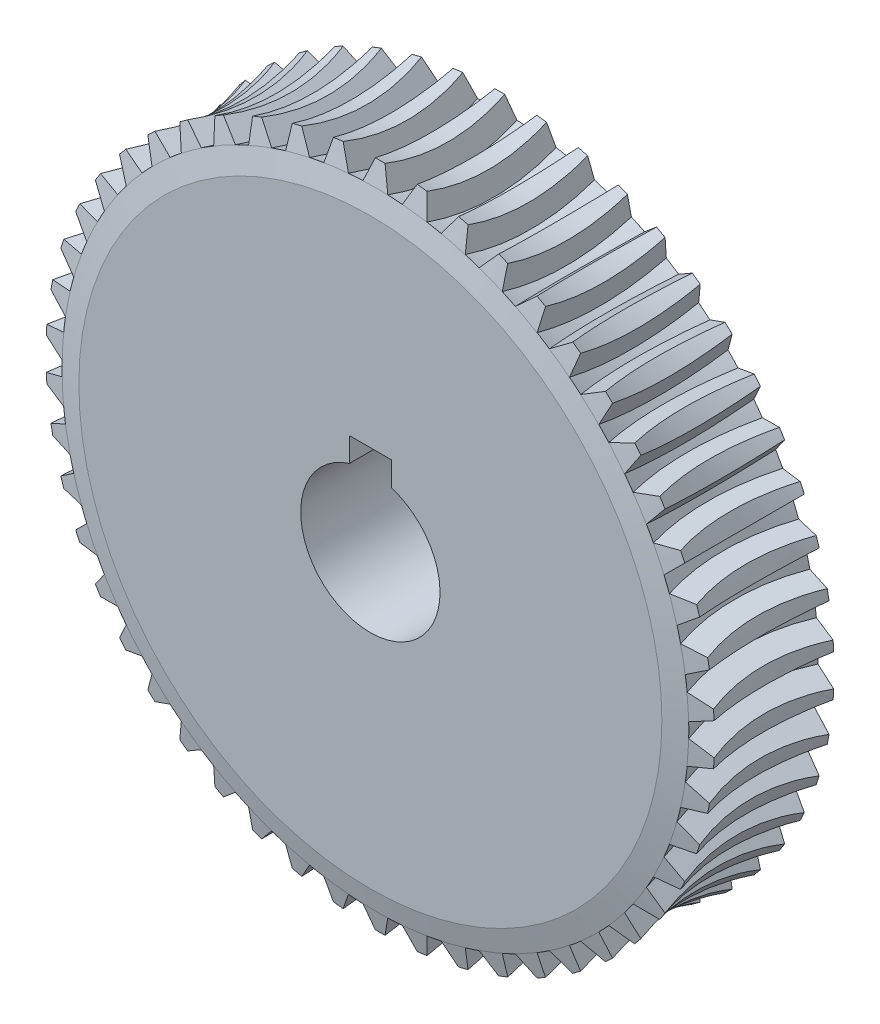
from build123d import *

# Parameters (mm, degrees)
SKETCH1_R               = 22.5
BOSS_EXTRUDE1_DEPTH     = 10
BOSS_EXTRUDE2_DEPTH     = 9.28
CIRPATTERN1_COUNT       = 50
SKETCH7_R               = 11.5
BOSS_EXTRUDE3_DEPTH     = 6.8
CUT_EXTRUDE1_DEPTH      = 38.855281345
CUT_EXTRUDE1_DEPTH_BACK = 38.855281345
SKETCH8_R               = 5
CUT_EXTRUDE2_DEPTH      = 38.855281345
CUT_EXTRUDE2_DEPTH_BACK = 38.855281345
SKETCH9_W               = 3
SKETCH9_H               = 4.772104456


with BuildPart() as part:
    # Sketch1 → Boss-Extrude1 (new body)
    with BuildSketch(Plane.XY):
        Circle(SKETCH1_R)
    extrude(amount=BOSS_EXTRUDE1_DEPTH)

    # Sketch2 → Cut-Revolve1 (revolve, cut)
    with BuildSketch(Plane(origin=(0, 0, 0), x_dir=(1, 0, 0), z_dir=(0, 1, 0))):
        Polygon((-22.5, -9.64), (-22.5, -10), (-20.93, -10), align=None)
        Polygon((-22.5, -0.36), (-20.93, 0), (-22.5, 0), align=None)
    revolve(axis=Axis((0, 0, 10), (0, 0, -1)), mode=Mode.SUBTRACT)

    # Sketch3 → Cut-Revolve2 (revolve, cut)
    with BuildSketch(Plane(origin=(0, 0, 0), x_dir=(1, 0, 0), z_dir=(0, 1, 0))):
        with BuildLine():
            ThreePointArc((-22.5, -9.64), (-21.830796064, -5), (-22.5, -0.36))
            Line((-22.5, -0.36), (-22.5, -9.64))
        make_face()
    revolve(axis=Axis((0, 0, 0), (0, 0, 1)), mode=Mode.SUBTRACT)

    # Sketch4 → Boss-Extrude2 (add)
    with BuildSketch(Plane(origin=(0, 0, 0.36), x_dir=(-1, 0, 0), z_dir=(0, 0, -1))):
        Polygon((-0.35, 24), (-0.89, 22.482390887), (-1.237647162, 21.505367738), (-0.89, 21.505367738), (0.89, 21.505367738), (1.237647162, 21.505367738), (0.89, 22.482390887), (0.35, 24), align=None)
    boss_extrude2 = extrude(amount=-BOSS_EXTRUDE2_DEPTH)

    # CirPattern1: Boss-Extrude2 ×50 about axis
    cirpattern1_axis = Axis((0, 0, 0.36), (0, 0, -1))
    for i in range(1, CIRPATTERN1_COUNT):
        add(boss_extrude2.rotate(cirpattern1_axis, i * 360 / CIRPATTERN1_COUNT))

    # Sketch5 → Cut-Revolve3 (revolve, cut)
    with BuildSketch(Plane(origin=(0, 0, 0), x_dir=(0, 0, -1), z_dir=(1, 0, 0))):
        Polygon((-1.165710418, 26.003012651), (-0.36, 22.489219995), (-0.36, 26.003012651), align=None)
        Polygon((-9.64, 26.003012651), (-9.64, 22.489219995), (-8.834289582, 26.003012651), align=None)
    revolve(axis=Axis((0, 0, 0), (0, 0, 1)), mode=Mode.SUBTRACT)

    # Sketch6 → Cut-Revolve7 (revolve, cut)
    with BuildSketch(Plane(origin=(0, 0, 0), x_dir=(0, 0, -1), z_dir=(1, 0, 0))):
        with BuildLine():
            ThreePointArc((-9.292993947, 24), (-5, 23.320105319), (-0.707006053, 24))
            Line((-0.707006053, 24), (-0.707006053, 27.342935603))
            Line((-0.707006053, 27.342935603), (-9.292993947, 27.342935603))
            Line((-9.292993947, 27.342935603), (-9.292993947, 24))
        make_face()
    revolve(axis=Axis((0, 0, 10), (0, 0, -1)), mode=Mode.SUBTRACT)

    # Sketch7 → Boss-Extrude3 (add)
    with BuildSketch(Plane(origin=(0, 0, 0), x_dir=(-1, 0, 0), z_dir=(0, 0, -1))):
        Circle(SKETCH7_R)
    extrude(amount=BOSS_EXTRUDE3_DEPTH)

    # Sketch8 → Cut-Extrude1 (cut, two sides: drawn at the far end of the back side and taken through both)
    with BuildSketch(Plane(origin=(0, 0, -6.8), x_dir=(-1, 0, 0), z_dir=(0, 0, -1)).offset(-CUT_EXTRUDE1_DEPTH_BACK)):
        Circle(SKETCH8_R)
    extrude(amount=CUT_EXTRUDE1_DEPTH + CUT_EXTRUDE1_DEPTH_BACK, mode=Mode.SUBTRACT)

    # Sketch9 → Cut-Extrude2 (cut, two sides: drawn at the far end of the back side and taken through both)
    with BuildSketch(Plane(origin=(0, 0, -6.8), x_dir=(-1, 0, 0), z_dir=(0, 0, -1)).offset(-CUT_EXTRUDE2_DEPTH_BACK)):
        with Locations((0, 4.113947772)):
            Rectangle(SKETCH9_W, SKETCH9_H)
    extrude(amount=CUT_EXTRUDE2_DEPTH + CUT_EXTRUDE2_DEPTH_BACK, mode=Mode.SUBTRACT)


solid = part.part
